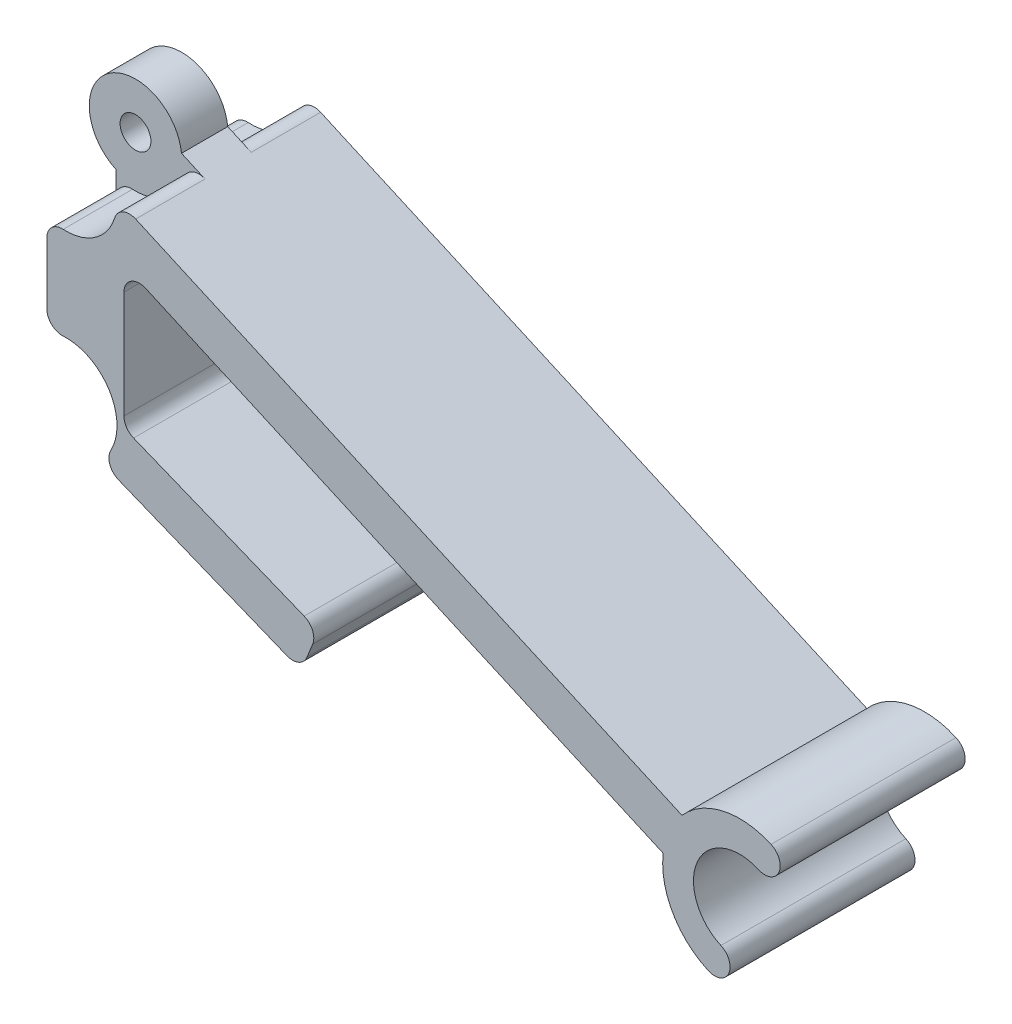
from build123d import *

# Parameters (mm, degrees)
SKETCH1_R           = 1
BOSS_EXTRUDE1_DEPTH = 12
SKETCH2_R           = 3.3
CUT_EXTRUDE1_DEPTH  = 4.5
FILLET1_R           = 1
FILLET2_R           = 1
FILLET3_R           = 1
FILLET6_R           = 1


with BuildPart() as part:
    # Sketch1 → Boss-Extrude1 (new body)
    with BuildSketch(Plane.XY):
        with BuildLine():
            Line((0.332668694, 15.169303239), (0.332668694, 22.304947181))
            ThreePointArc((0.332668694, 22.304947181), (-0.167437886, 27.468747249), (4.56623438, 25.3457106))
            Line((4.56623438, 25.3457106), (41.53945423, 8.884172534))
            ThreePointArc((41.53945423, 8.884172534), (44.223987307, 10.459606893), (47.320366603, 10.141571494))
            ThreePointArc((47.320366603, 10.141571494), (47.827175417, 8.821289393), (46.506893317, 8.314480578))
            ThreePointArc((46.506893317, 8.314480578), (42.546047014, 6.794054135), (44.066473458, 2.833207832))
            ThreePointArc((44.066473458, 2.833207832), (44.573282273, 1.512925732), (43.253000172, 1.006116917))
            ThreePointArc((43.253000172, 1.006116917), (40.944771655, 3.094367949), (40.319244301, 6.143536161))
            Line((40.319244301, 6.143536161), (5.332668694, 21.720563222))
            Line((5.332668694, 21.720563222), (5.332668694, 12.544828977))
            Line((5.332668694, 12.544828977), (17.953063304, 7.445858574))
            Line((17.953063304, 7.445858574), (16.829243524, 4.66430701))
            Line((16.829243524, 4.66430701), (3.42965312, 10.078092949))
            ThreePointArc((3.42965312, 10.078092949), (-0.980376986, 10.883023916), (0.332668694, 15.169303239))
        make_face()
        with Locations((1.582668694, 25.03212521)):
            Circle(SKETCH1_R, mode=Mode.SUBTRACT)
        with Locations((1.582668694, 12.44212521)):
            Circle(SKETCH1_R, mode=Mode.SUBTRACT)
    extrude(amount=BOSS_EXTRUDE1_DEPTH)

    # Sketch2 → Cut-Extrude1 (cut)
    with BuildSketch(Plane.XY.offset(12)):
        with Locations((1.582668694, 25.03212521)):
            Circle(SKETCH2_R)
        with Locations((1.582668694, 12.44212521)):
            Circle(SKETCH2_R)
    cut_extrude1 = extrude(amount=-CUT_EXTRUDE1_DEPTH, mode=Mode.SUBTRACT)

    # Mirror1: Cut-Extrude1 across plane
    add(cut_extrude1.mirror(Plane.XY.offset(6)), mode=Mode.SUBTRACT)

    # Fillet1
    fillet1_edges = [part.edges().sort_by_distance(p)[0] for p in [
        (0.332668694, 15.496220821, 2.25),
        (0.332668694, 15.496220821, 9.75),
        (0.332668694, 21.978029599, 2.25),
        (0.332668694, 21.978029599, 9.75),
    ]]
    fillet(fillet1_edges, radius=FILLET1_R)

    # Fillet2
    fillet2_edges = [part.edges().sort_by_distance(p)[0] for p in [
        (16.829243524, 4.66430701, 6),
        (17.953063304, 7.445858574, 6),
    ]]
    fillet(fillet2_edges, radius=FILLET2_R)

    # Fillet3
    fillet3_edges = [part.edges().sort_by_distance(p)[0] for p in [
        (5.332668694, 21.720563222, 6),
        (5.332668694, 12.544828977, 6),
    ]]
    fillet(fillet3_edges, radius=FILLET3_R)

    # Fillet6
    fillet6_edges = [part.edges().sort_by_distance(p)[0] for p in [
        (3.746111613, 9.950235418, 2.25),
        (3.746111613, 9.950235418, 9.75),
        (4.878037932, 25.206886714, 2.25),
        (4.878037932, 25.206886714, 9.75),
    ]]
    fillet(fillet6_edges, radius=FILLET6_R)


solid = part.part
